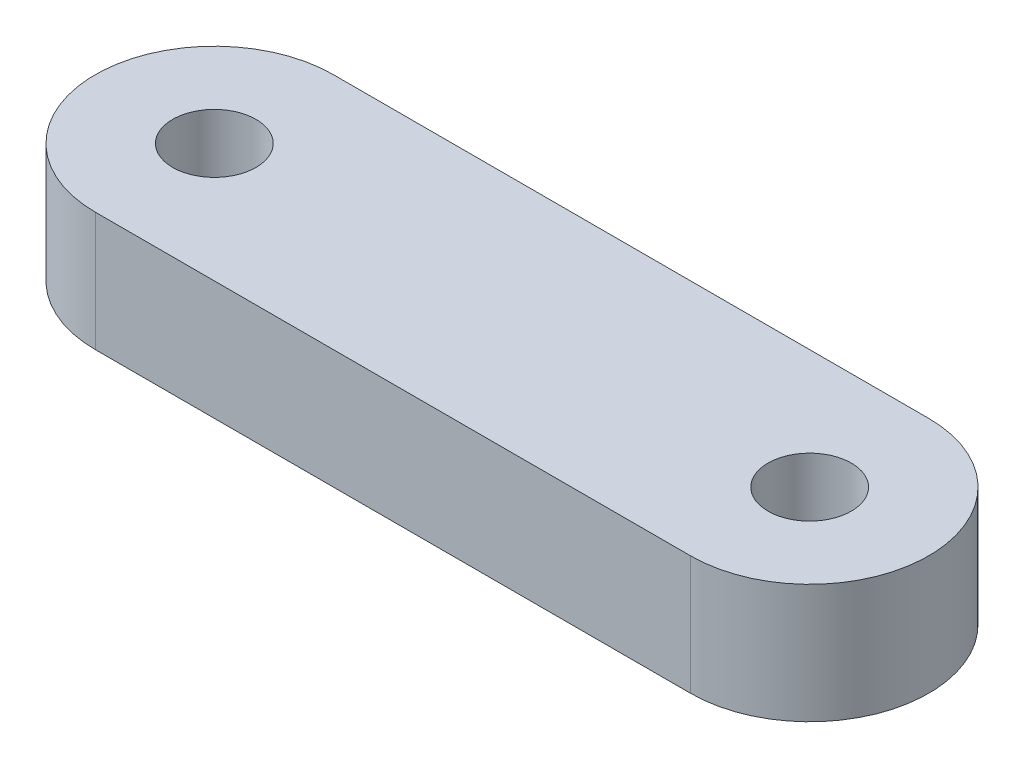
from build123d import *

# Parameters (mm, degrees)
SKETCH1_R           = 3.5
BOSS_EXTRUDE1_DEPTH = 10


with BuildPart() as part:
    # Sketch1 → Boss-Extrude1 (new body)
    with BuildSketch(Plane(origin=(0, 0, 0), x_dir=(1, 0, 0), z_dir=(0, 1, 0))):
        with BuildLine():
            Line((25, 10), (-25, 10))
            ThreePointArc((-25, 10), (-35, 0), (-25, -10))
            Line((-25, -10), (25, -10))
            ThreePointArc((25, -10), (35, 0), (25, 10))
        make_face()
        with Locations((-25, 0)):
            Circle(SKETCH1_R, mode=Mode.SUBTRACT)
        with Locations((25, 0)):
            Circle(SKETCH1_R, mode=Mode.SUBTRACT)
    extrude(amount=BOSS_EXTRUDE1_DEPTH)


solid = part.part
